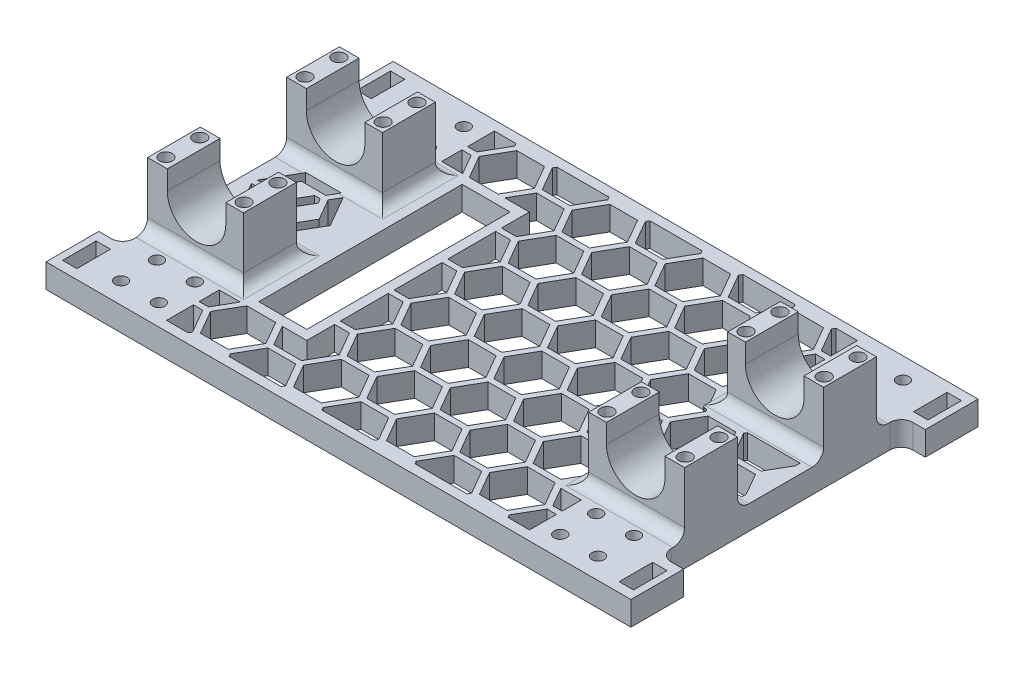
from build123d import *

# Parameters (mm, degrees)
SKETCH1_W               = 134.62
SKETCH1_H               = 91.948
BOSS_EXTRUDE1_DEPTH     = 6.35
SKETCH2_R               = 1.6256
CUT_EXTRUDE1_DEPTH      = 82.759203005
SKETCH3_W               = 13.97
SKETCH3_H               = 6.35
BOSS_EXTRUDE3_DEPTH     = 10.16
SKETCH5_W               = 3.81
SKETCH5_H               = 8.89
CUT_EXTRUDE2_DEPTH      = 4.445
MIRROR2_COPY_1_SKETCH_W = 13.97
MIRROR2_COPY_1_SKETCH_H = 6.35
MIRROR2_COPY_1_DEPTH    = 10.16
MIRROR2_COPY_2_SKETCH_W = 3.81
MIRROR2_COPY_2_SKETCH_H = 8.89
MIRROR2_COPY_2_DEPTH    = 4.445
SKETCH7_W               = 64.008
SKETCH7_H               = 6.35
BOSS_EXTRUDE4_DEPTH     = 3.81
BOSS_EXTRUDE5_START     = -25.4
BOSS_EXTRUDE5_DEPTH     = 13.97
BOSS_EXTRUDE5_START_2   = 11.43
BOSS_EXTRUDE5_2_DEPTH   = 13.97
SKETCH10_R              = 1.7145
CUT_EXTRUDE5_DEPTH      = 5.08
FILLET6_R               = 3.048
BOSS_EXTRUDE6_START     = -25.4
BOSS_EXTRUDE6_DEPTH     = 13.97
BOSS_EXTRUDE6_START_2   = 11.43
BOSS_EXTRUDE6_2_DEPTH   = 13.97
FILLET7_R               = 3.048
SKETCH12_W              = 12.7
SKETCH12_H              = 53.848
CUT_EXTRUDE6_DEPTH      = 92.641769214
CUT_EXTRUDE7_DEPTH      = 92.641769214
FILLET8_R               = 0.635
CUT_EXTRUDE8_DEPTH      = 92.641769214
CUT_EXTRUDE8_DEPTH_BACK = 92.641769214


# Read off the part's stored shape, not the designer's step: Boss-Extrude5, Boss-Extrude6
with BuildPart() as part:
    # Sketch1 → Boss-Extrude1 (new body)
    with BuildSketch(Plane(origin=(0, 0, 0), x_dir=(1, 0, 0), z_dir=(0, 1, 0))):
        Rectangle(SKETCH1_W, SKETCH1_H)
    extrude(amount=BOSS_EXTRUDE1_DEPTH)

    # Sketch2 → Cut-Extrude1 (cut, through all)
    with BuildSketch(Plane(origin=(0, 6.35, 0), x_dir=(1, 0, 0), z_dir=(0, 1, 0))):
        with Locations(Location((-63.1698, 40.386, 0), (0, 0, 270))):
            Circle(SKETCH2_R)
        with Locations(Location((63.1698, 40.386, 0), (0, 0, 270))):
            Circle(SKETCH2_R)
        with Locations(Location((63.1698, -40.386, 0), (0, 0, 270))):
            Circle(SKETCH2_R)
        with Locations(Location((-63.1698, -40.386, 0), (0, 0, 270))):
            Circle(SKETCH2_R)
        with Locations(Location((-53.1622, -40.386, 0), (0, 0, 270))):
            Circle(SKETCH2_R)
        with Locations(Location((-53.1622, -30.861, 0), (0, 0, 270))):
            Circle(SKETCH2_R)
        with Locations(Location((-63.1698, -30.861, 0), (0, 0, 270))):
            Circle(SKETCH2_R)
        with Locations(Location((-53.1622, 40.386, 0), (0, 0, 90))):
            Circle(SKETCH2_R)
        with Locations(Location((-53.1622, 30.861, 0), (0, 0, 90))):
            Circle(SKETCH2_R)
        with Locations(Location((-63.1698, 30.861, 0), (0, 0, 90))):
            Circle(SKETCH2_R)
        with Locations(Location((53.1622, -40.386, 0), (0, 0, 90))):
            Circle(SKETCH2_R)
        with Locations(Location((63.1698, -30.861, 0), (0, 0, 90))):
            Circle(SKETCH2_R)
        with Locations(Location((53.1622, -30.861, 0), (0, 0, 90))):
            Circle(SKETCH2_R)
        with Locations(Location((53.1622, 40.386, 0), (0, 0, 270))):
            Circle(SKETCH2_R)
        with Locations(Location((53.1622, 30.861, 0), (0, 0, 270))):
            Circle(SKETCH2_R)
        with Locations(Location((63.1698, 30.861, 0), (0, 0, 270))):
            Circle(SKETCH2_R)
    extrude(amount=-CUT_EXTRUDE1_DEPTH, mode=Mode.SUBTRACT)

    # Sketch3 → Boss-Extrude3 (add)
    with BuildSketch(Plane.ZY.offset(67.31)):
        with Locations((-38.989, 3.175)):
            Rectangle(SKETCH3_W, SKETCH3_H)
    boss_extrude3 = extrude(amount=BOSS_EXTRUDE3_DEPTH)

    # Sketch5 → Cut-Extrude2 (cut)
    with BuildSketch(Plane(origin=(0, 6.35, 0), x_dir=(1, 0, 0), z_dir=(0, 1, 0))):
        with Locations((-73.717727273, 38.989)):
            Rectangle(SKETCH5_W, SKETCH5_H)
    cut_extrude2 = extrude(amount=-CUT_EXTRUDE2_DEPTH, mode=Mode.SUBTRACT)

    # Mirror1: Boss-Extrude3, Cut-Extrude2 across plane
    add(boss_extrude3.mirror(Plane.XY))
    add(cut_extrude2.mirror(Plane.XY), mode=Mode.SUBTRACT)

    # Mirror2: Boss-Extrude3, Cut-Extrude2 across plane
    add(boss_extrude3.mirror(Plane(origin=(0, 0, 0), x_dir=(0, 0, 1), z_dir=(1, 0, 0))))
    add(cut_extrude2.mirror(Plane(origin=(0, 0, 0), x_dir=(0, 0, 1), z_dir=(1, 0, 0))), mode=Mode.SUBTRACT)

    # Mirror2 copy 1 sketch → Mirror2 copy 1 (add)
    with BuildSketch(Plane(origin=(67.31, 0, 0), x_dir=(0, 0, -1), z_dir=(1, 0, 0))):
        with Locations((-38.989, 3.175)):
            Rectangle(MIRROR2_COPY_1_SKETCH_W, MIRROR2_COPY_1_SKETCH_H)
    extrude(amount=MIRROR2_COPY_1_DEPTH)

    # Mirror2 copy 2 sketch → Mirror2 copy 2 (cut)
    with BuildSketch(Plane(origin=(0, 6.35, 0), x_dir=(-1, 0, 0), z_dir=(0, 1, 0))):
        with Locations((-73.717727273, 38.989)):
            Rectangle(MIRROR2_COPY_2_SKETCH_W, MIRROR2_COPY_2_SKETCH_H)
    extrude(amount=-MIRROR2_COPY_2_DEPTH, mode=Mode.SUBTRACT)

    # Sketch7 → Boss-Extrude4 (add)
    with BuildSketch(Plane.ZY.offset(67.31)):
        with Locations((0, 3.175)):
            Rectangle(SKETCH7_W, SKETCH7_H)
    boss_extrude4 = extrude(amount=BOSS_EXTRUDE4_DEPTH)

    # Mirror3: Boss-Extrude4 across plane
    add(boss_extrude4.mirror(Plane(origin=(0, 0, 0), x_dir=(0, 0, 1), z_dir=(1, 0, 0))))

    # Boss-Extrude5 outline → Boss-Extrude5 (add)
    with BuildSketch(Plane.XY.offset(BOSS_EXTRUDE5_START)):
        with BuildLine():
            Line((-65.913, 23.172731308), (-71.12, 23.172731308))
            Line((-71.12, 23.172731308), (-71.12, 6.35))
            Line((-71.12, 6.35), (-45.72, 6.35))
            Line((-45.72, 6.35), (-45.72, 23.172731308))
            Line((-45.72, 23.172731308), (-50.419, 23.172731308))
            Line((-50.419, 23.172731308), (-50.419, 18.0848))
            ThreePointArc((-50.419, 18.0848), (-58.166, 10.3378), (-65.913, 18.0848))
            Line((-65.913, 18.0848), (-65.913, 23.172731308))
        make_face()
    extrude(amount=BOSS_EXTRUDE5_DEPTH)

    # Boss-Extrude5 2 outline → Boss-Extrude5 2 (add)
    with BuildSketch(Plane.XY.offset(BOSS_EXTRUDE5_START_2)):
        with BuildLine():
            Line((-65.913, 23.172731308), (-71.12, 23.172731308))
            Line((-71.12, 23.172731308), (-71.12, 6.35))
            Line((-71.12, 6.35), (-45.72, 6.35))
            Line((-45.72, 6.35), (-45.72, 23.172731308))
            Line((-45.72, 23.172731308), (-50.419, 23.172731308))
            Line((-50.419, 23.172731308), (-50.419, 18.0848))
            ThreePointArc((-50.419, 18.0848), (-58.166, 10.3378), (-65.913, 18.0848))
            Line((-65.913, 18.0848), (-65.913, 23.172731308))
        make_face()
    extrude(amount=BOSS_EXTRUDE5_2_DEPTH)

    # Sketch10 → Cut-Extrude5 (cut)
    with BuildSketch(Plane(origin=(0, 23.172731308, 0), x_dir=(1, 0, 0), z_dir=(0, 1, 0))):
        with Locations(Location((-48.0695, 13.927576976, 0), (0, 0, 270))):
            Circle(SKETCH10_R)
        with Locations(Location((-48.0695, 22.902423024, 0), (0, 0, 90))):
            Circle(SKETCH10_R)
        with Locations(Location((-68.7705, 13.927576976, 0), (0, 0, 90))):
            Circle(SKETCH10_R)
        with Locations(Location((-68.7705, 22.902423024, 0), (0, 0, 270))):
            Circle(SKETCH10_R)
        with Locations(Location((-48.0695, -13.927576976, 0), (0, 0, 90))):
            Circle(SKETCH10_R)
        with Locations(Location((-48.0695, -22.902423024, 0), (0, 0, 270))):
            Circle(SKETCH10_R)
        with Locations(Location((-68.7705, -22.902423024, 0), (0, 0, 90))):
            Circle(SKETCH10_R)
        with Locations(Location((-68.7705, -13.927576976, 0), (0, 0, 270))):
            Circle(SKETCH10_R)
    cut_extrude5 = extrude(amount=-CUT_EXTRUDE5_DEPTH, mode=Mode.SUBTRACT)

    # Fillet6
    fillet6_edges = [part.edges().sort_by_distance(p)[0] for p in [
        (-71.12, 3.175, -32.004),
        (-71.12, 3.175, 32.004),
        (-58.42, 6.35, -11.43),
        (-58.42, 6.35, -25.4),
        (-45.72, 6.35, -18.415),
        (-58.42, 6.35, 11.43),
        (-45.72, 6.35, 18.415),
        (-58.42, 6.35, 25.4),
    ]]
    fillet(fillet6_edges, radius=FILLET6_R)

    # Boss-Extrude6 outline → Boss-Extrude6 (add)
    with BuildSketch(Plane.XY.offset(BOSS_EXTRUDE6_START)):
        with BuildLine():
            Line((45.72, 6.35), (71.12, 6.35))
            Line((71.12, 6.35), (71.12, 23.172731308))
            Line((71.12, 23.172731308), (65.913, 23.172731308))
            Line((65.913, 23.172731308), (65.913, 18.0848))
            ThreePointArc((65.913, 18.0848), (58.166, 10.3378), (50.419, 18.0848))
            Line((50.419, 18.0848), (50.419, 23.172731308))
            Line((50.419, 23.172731308), (45.72, 23.172731308))
            Line((45.72, 23.172731308), (45.72, 6.35))
        make_face()
    extrude(amount=BOSS_EXTRUDE6_DEPTH)

    # Boss-Extrude6 2 outline → Boss-Extrude6 2 (add)
    with BuildSketch(Plane.XY.offset(BOSS_EXTRUDE6_START_2)):
        with BuildLine():
            Line((45.72, 6.35), (71.12, 6.35))
            Line((71.12, 6.35), (71.12, 23.172731308))
            Line((71.12, 23.172731308), (65.913, 23.172731308))
            Line((65.913, 23.172731308), (65.913, 18.0848))
            ThreePointArc((65.913, 18.0848), (58.166, 10.3378), (50.419, 18.0848))
            Line((50.419, 18.0848), (50.419, 23.172731308))
            Line((50.419, 23.172731308), (45.72, 23.172731308))
            Line((45.72, 23.172731308), (45.72, 6.35))
        make_face()
    extrude(amount=BOSS_EXTRUDE6_2_DEPTH)

    # Mirror14: Cut-Extrude5 across plane
    add(cut_extrude5.mirror(Plane(origin=(0, 0, 0), x_dir=(0, 0, 1), z_dir=(1, 0, 0))), mode=Mode.SUBTRACT)

    # Fillet7
    fillet7_edges = [part.edges().sort_by_distance(p)[0] for p in [
        (71.12, 3.175, -32.004),
        (71.12, 3.175, 32.004),
        (58.42, 6.35, -11.43),
        (45.72, 6.35, -18.415),
        (58.42, 6.35, -25.4),
        (45.72, 6.35, 18.415),
        (58.42, 6.35, 11.43),
        (58.42, 6.35, 25.4),
    ]]
    fillet(fillet7_edges, radius=FILLET7_R)

    # Sketch12 → Cut-Extrude6 (cut, through all)
    with BuildSketch(Plane(origin=(0, 6.35, 0), x_dir=(1, 0, 0), z_dir=(0, 1, 0))):
        with Locations((-33.782, 0)):
            Rectangle(SKETCH12_W, SKETCH12_H)
    extrude(amount=-CUT_EXTRUDE6_DEPTH, mode=Mode.SUBTRACT)

    # Sketch13 → Cut-Extrude7 (cut, through all)
    with BuildSketch(Plane(origin=(0, 6.35, 0), x_dir=(1, 0, 0), z_dir=(0, 1, 0))):
        Polygon((40.62121024, -13.462), (42.672, -9.909927939), (42.672, -7.747), (43.920767028, -7.747), (44.287384449, -7.112), (40.62121024, -0.762), (33.288861821, -0.762), (29.622687612, -7.112), (33.288861821, -13.462), align=None)
        Polygon((42.672, -24.133927939), (42.672, -18.538072061), (40.62121024, -14.986), (33.288861821, -14.986), (29.622687612, -21.336), (33.288861821, -27.686), (40.62121024, -27.686), align=None)
        Polygon((54.259378298, -7.112), (54.625995719, -7.747), (68.58, -7.747), (68.58, -6.516044383), (65.257900927, -0.762), (57.925552508, -0.762), align=None)
        Polygon((48.0822, -29.718), (42.674267797, -29.718), (45.607207164, -34.798), (48.0822, -34.798), align=None)
        Polygon((65.257900927, 0.762), (68.58, 6.516044383), (68.58, 7.747), (54.625995719, 7.747), (54.259378298, 7.112), (57.925552508, 0.762), align=None)
        Polygon((48.0822, -43.434), (48.0822, -36.322), (45.607207164, -36.322), (41.941032955, -42.672), (42.38097386, -43.434), align=None)
        Polygon((44.287384449, 7.112), (43.920767028, 7.747), (42.672, 7.747), (42.672, 9.909927939), (40.62121024, 13.462), (33.288861821, 13.462), (29.622687612, 7.112), (33.288861821, 0.762), (40.62121024, 0.762), align=None)
        Polygon((17.744283173, -43.434), (31.5290982, -43.434), (31.969039106, -42.672), (28.302864896, -36.322), (20.970516478, -36.322), (17.304342268, -42.672), align=None)
        Polygon((-6.892407514, -43.434), (6.892407514, -43.434), (7.332348419, -42.672), (3.666174209, -36.322), (-3.666174209, -36.322), (-7.332348419, -42.672), align=None)
        Polygon((40.62121024, 14.986), (42.672, 18.538072061), (42.672, 24.133927939), (40.62121024, 27.686), (33.288861821, 27.686), (29.622687612, 21.336), (33.288861821, 14.986), align=None)
        Polygon((-31.5290982, -43.434), (-17.744283173, -43.434), (-17.304342268, -42.672), (-20.970516478, -36.322), (-28.302864896, -36.322), (-31.969039106, -42.672), align=None)
        Polygon((-48.0822, -43.434), (-42.38097386, -43.434), (-41.941032955, -42.672), (-45.607207164, -36.322), (-48.0822, -36.322), align=None)
        Polygon((45.607207164, 34.798), (42.674267797, 29.718), (48.0822, 29.718), (48.0822, 34.798), align=None)
        Polygon((-48.0822, -29.464), (-48.0822, -34.798), (-45.607207164, -34.798), (-42.527620829, -29.464), align=None)
        Polygon((45.607207164, 36.322), (48.0822, 36.322), (48.0822, 43.434), (42.38097386, 43.434), (41.941032955, 42.672), align=None)
        Polygon((-33.142214853, -29.464), (-40.767857208, -29.464), (-44.287384449, -35.56), (-40.62121024, -41.91), (-33.288861821, -41.91), (-29.622687612, -35.56), align=None)
        Polygon((31.969039106, 42.672), (31.5290982, 43.434), (17.744283173, 43.434), (17.304342268, 42.672), (20.970516478, 36.322), (28.302864896, 36.322), align=None)
        Polygon((-24.892, -29.464), (-31.382451232, -29.464), (-28.302864896, -34.798), (-20.970516478, -34.798), (-17.304342268, -28.448), (-20.970516478, -22.098), (-24.892, -22.098), align=None)
        Polygon((7.332348419, 42.672), (6.892407514, 43.434), (-6.892407514, 43.434), (-7.332348419, 42.672), (-3.666174209, 36.322), (3.666174209, 36.322), align=None)
        Polygon((-17.304342268, 42.672), (-17.744283173, 43.434), (-31.5290982, 43.434), (-31.969039106, 42.672), (-28.302864896, 36.322), (-20.970516478, 36.322), align=None)
        Polygon((-24.892, -7.874), (-24.892, -20.574), (-20.970516478, -20.574), (-17.304342268, -14.224), (-20.970516478, -7.874), align=None)
        Polygon((-41.941032955, 42.672), (-42.38097386, 43.434), (-48.0822, 43.434), (-48.0822, 36.322), (-45.607207164, 36.322), align=None)
        Polygon((-24.892, 6.35), (-24.892, -6.35), (-20.970516478, -6.35), (-17.304342268, 0), (-20.970516478, 6.35), align=None)
        Polygon((-24.892, 20.574), (-24.892, 7.874), (-20.970516478, 7.874), (-17.304342268, 14.224), (-20.970516478, 20.574), align=None)
        Polygon((-45.607207164, 34.798), (-48.0822, 34.798), (-48.0822, 29.464), (-42.527620829, 29.464), align=None)
        Polygon((-24.892, 29.464), (-24.892, 22.098), (-20.970516478, 22.098), (-17.304342268, 28.448), (-20.970516478, 34.798), (-28.302864896, 34.798), (-31.382451232, 29.464), align=None)
        Polygon((-44.287384449, 35.56), (-40.767857208, 29.464), (-33.142214853, 29.464), (-29.622687612, 35.56), (-33.288861821, 41.91), (-40.62121024, 41.91), align=None)
        Polygon((3.666174209, -6.35), (7.332348419, 0), (3.666174209, 6.35), (-3.666174209, 6.35), (-7.332348419, 0), (-3.666174209, -6.35), align=None)
        Polygon((15.984519553, 0.762), (19.650693762, 7.112), (15.984519553, 13.462), (8.652171134, 13.462), (4.985996925, 7.112), (8.652171134, 0.762), align=None)
        Polygon((3.666174209, 7.874), (7.332348419, 14.224), (3.666174209, 20.574), (-3.666174209, 20.574), (-7.332348419, 14.224), (-3.666174209, 7.874), align=None)
        Polygon((-8.652171134, 0.762), (-4.985996925, 7.112), (-8.652171134, 13.462), (-15.984519553, 13.462), (-19.650693762, 7.112), (-15.984519553, 0.762), align=None)
        Polygon((-8.652171134, 14.986), (-4.985996925, 21.336), (-8.652171134, 27.686), (-15.984519553, 27.686), (-19.650693762, 21.336), (-15.984519553, 14.986), align=None)
        Polygon((3.666174209, 22.098), (7.332348419, 28.448), (3.666174209, 34.798), (-3.666174209, 34.798), (-7.332348419, 28.448), (-3.666174209, 22.098), align=None)
        Polygon((15.984519553, 14.986), (19.650693762, 21.336), (15.984519553, 27.686), (8.652171134, 27.686), (4.985996925, 21.336), (8.652171134, 14.986), align=None)
        Polygon((15.984519553, 29.21), (19.650693762, 35.56), (15.984519553, 41.91), (8.652171134, 41.91), (4.985996925, 35.56), (8.652171134, 29.21), align=None)
        Polygon((28.302864896, -6.35), (31.969039106, 0), (28.302864896, 6.35), (20.970516478, 6.35), (17.304342268, 0), (20.970516478, -6.35), align=None)
        Polygon((17.304342268, 14.224), (20.970516478, 7.874), (28.302864896, 7.874), (31.969039106, 14.224), (28.302864896, 20.574), (20.970516478, 20.574), align=None)
        Polygon((28.302864896, 22.098), (31.969039106, 28.448), (28.302864896, 34.798), (20.970516478, 34.798), (17.304342268, 28.448), (20.970516478, 22.098), align=None)
        Polygon((40.62121024, 29.21), (44.287384449, 35.56), (40.62121024, 41.91), (33.288861821, 41.91), (29.622687612, 35.56), (33.288861821, 29.21), align=None)
        Polygon((45.607207164, 6.35), (41.941032955, 0), (45.607207164, -6.35), (52.939555583, -6.35), (56.605729792, 0), (52.939555583, 6.35), align=None)
        Polygon((-8.652171134, 29.21), (-4.985996925, 35.56), (-8.652171134, 41.91), (-15.984519553, 41.91), (-19.650693762, 35.56), (-15.984519553, 29.21), align=None)
        Polygon((-4.985996925, -35.56), (-8.652171134, -29.21), (-15.984519553, -29.21), (-19.650693762, -35.56), (-15.984519553, -41.91), (-8.652171134, -41.91), align=None)
        Polygon((44.287384449, -35.56), (40.62121024, -29.21), (33.288861821, -29.21), (29.622687612, -35.56), (33.288861821, -41.91), (40.62121024, -41.91), align=None)
        Polygon((31.969039106, -28.448), (28.302864896, -22.098), (20.970516478, -22.098), (17.304342268, -28.448), (20.970516478, -34.798), (28.302864896, -34.798), align=None)
        Polygon((17.304342268, -14.224), (20.970516478, -20.574), (28.302864896, -20.574), (31.969039106, -14.224), (28.302864896, -7.874), (20.970516478, -7.874), align=None)
        Polygon((19.650693762, -35.56), (15.984519553, -29.21), (8.652171134, -29.21), (4.985996925, -35.56), (8.652171134, -41.91), (15.984519553, -41.91), align=None)
        Polygon((19.650693762, -21.336), (15.984519553, -14.986), (8.652171134, -14.986), (4.985996925, -21.336), (8.652171134, -27.686), (15.984519553, -27.686), align=None)
        Polygon((7.332348419, -28.448), (3.666174209, -22.098), (-3.666174209, -22.098), (-7.332348419, -28.448), (-3.666174209, -34.798), (3.666174209, -34.798), align=None)
        Polygon((-4.985996925, -21.336), (-8.652171134, -14.986), (-15.984519553, -14.986), (-19.650693762, -21.336), (-15.984519553, -27.686), (-8.652171134, -27.686), align=None)
        Polygon((-4.985996925, -7.112), (-8.652171134, -0.762), (-15.984519553, -0.762), (-19.650693762, -7.112), (-15.984519553, -13.462), (-8.652171134, -13.462), align=None)
        Polygon((7.332348419, -14.224), (3.666174209, -7.874), (-3.666174209, -7.874), (-7.332348419, -14.224), (-3.666174209, -20.574), (3.666174209, -20.574), align=None)
        Polygon((19.650693762, -7.112), (15.984519553, -0.762), (8.652171134, -0.762), (4.985996925, -7.112), (8.652171134, -13.462), (15.984519553, -13.462), align=None)
    extrude(amount=-CUT_EXTRUDE7_DEPTH, mode=Mode.SUBTRACT)

    # Fillet8
    fillet8_edges = [part.edges().sort_by_distance(p)[0] for p in [
        (43.920767028, 3.175, 7.747),
        (42.672, 3.175, 7.747),
        (42.672, 3.175, 9.909927939),
        (42.672, 3.175, -9.909927939),
        (42.672, 3.175, -7.747),
        (43.920767028, 3.175, -7.747),
    ]]
    fillet(fillet8_edges, radius=FILLET8_R)

    # Sketch14 → Cut-Extrude8 (cut, two sides: drawn at the far end of the back side and taken through both)
    with BuildSketch(Plane(origin=(0, 6.35, 0), x_dir=(1, 0, 0), z_dir=(0, 1, 0)).offset(-CUT_EXTRUDE8_DEPTH_BACK)):
        Polygon((-54.900472759, -3.556), (-55.633707601, -4.826), (-57.100177285, -4.826), (-59.153234842, -1.27), (-63.259349956, -1.27), (-63.992584798, 0), (-63.259349956, 1.27), (-59.153234842, 1.27), (-57.100177285, 4.826), (-55.633707601, 4.826), (-54.900472759, 3.556), (-56.953530316, 0), align=None)
        Polygon((-55.633707601, 6.35), (-54.167237917, 8.89), (-63.552643893, 8.89), (-68.245346881, 0.762), (-65.312407514, 0.762), (-62.086174209, 6.35), align=None)
        Polygon((-52.847415202, -8.128), (-48.154712214, 0), (-52.847415202, 8.128), (-54.313884886, 5.588), (-51.087651581, 0), (-54.313884886, -5.588), align=None)
        Polygon((-63.552643893, -8.89), (-54.167237917, -8.89), (-55.633707601, -6.35), (-62.086174209, -6.35), (-65.312407514, -0.762), (-68.245346881, -0.762), align=None)
    extrude(amount=CUT_EXTRUDE8_DEPTH + CUT_EXTRUDE8_DEPTH_BACK, mode=Mode.SUBTRACT)


solid = part.part
